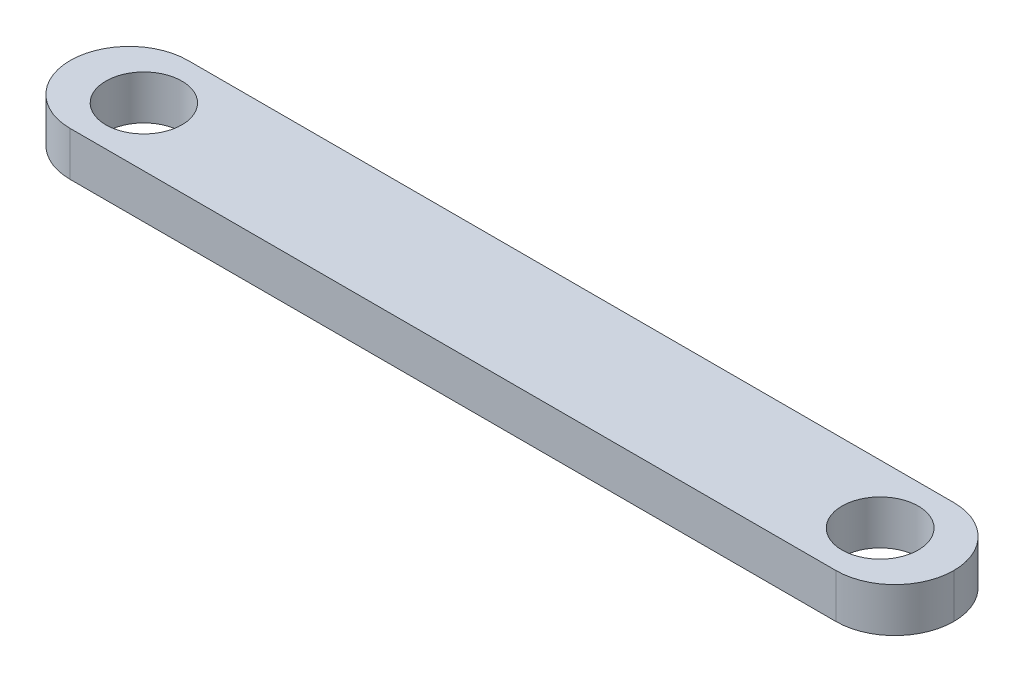
from build123d import *

# Parameters (mm, degrees)
SKETCH1_W           = 60
SKETCH1_H           = 8
SKETCH1_R           = 2.58
SKETCH1_R_2         = 2.59
BOSS_EXTRUDE1_DEPTH = 3
REDONDEO2_R         = 4


with BuildPart() as part:
    # Sketch1 → Boss-Extrude1 (new body)
    with BuildSketch(Plane(origin=(0, 0, 0), x_dir=(1, 0, 0), z_dir=(0, 1, 0))):
        Rectangle(SKETCH1_W, SKETCH1_H)
        with Locations(Location((-25, 0, 0), (0, 0, 270))):
            Circle(SKETCH1_R, mode=Mode.SUBTRACT)
        with Locations(Location((25, 0, 0), (0, 0, 270))):
            Circle(SKETCH1_R_2, mode=Mode.SUBTRACT)
    extrude(amount=BOSS_EXTRUDE1_DEPTH)

    # Redondeo2
    redondeo2_edges = [part.edges().sort_by_distance(p)[0] for p in [
        (30, 1.5, -4),
        (30, 1.5, 4),
        (-30, 1.5, -4),
        (-30, 1.5, 4),
    ]]
    fillet(redondeo2_edges, radius=REDONDEO2_R - 0.0001)  # a hair under: the kernel refuses the full size


solid = part.part
